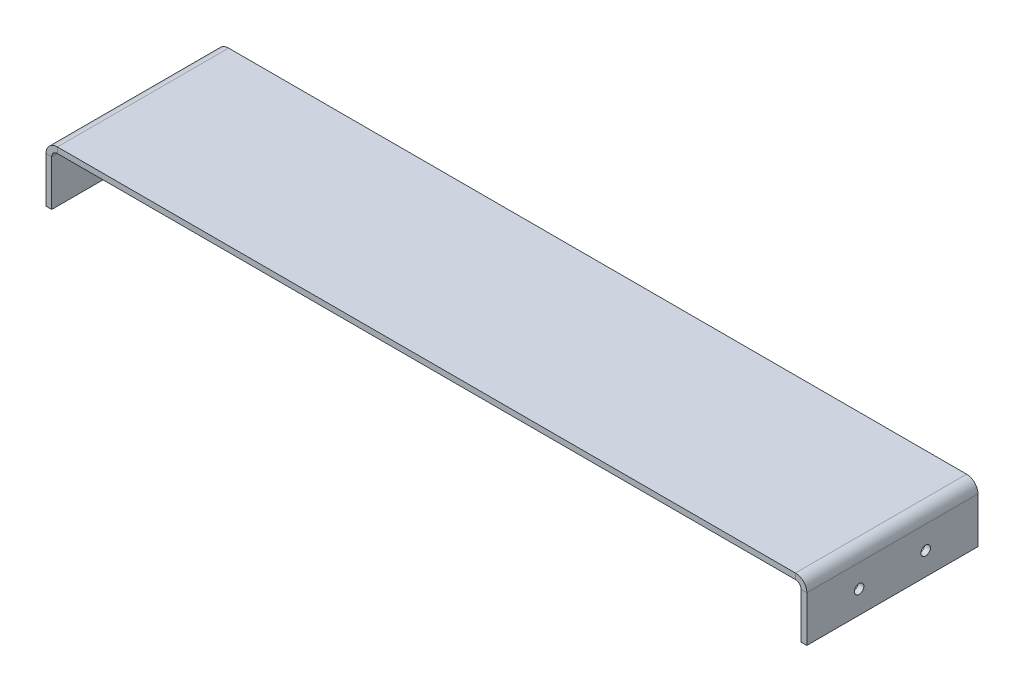
from build123d import *

# Parameters (mm, degrees)
SKETCH1_W                      = 400
SKETCH1_H                      = 90
BASE_FLANGE1_DEPTH             = 3
EDGE_FLANGE1_STRIP_W           = 18
EDGE_FLANGE1_STRIP_H           = 3
EDGE_FLANGE1_STRIP_CUT_DEPTH   = 90
EDGE_FLANGE1_STRIP_2_W         = 18
EDGE_FLANGE1_STRIP_2_H         = 3
EDGE_FLANGE1_STRIP_CUT_2_DEPTH = 90
EDGE_FLANGE1_DEPTH             = 90
EDGE_FLANGE1_BEND_DEPTH        = 90
SKETCH12_R                     = 2.5
CUT_EXTRUDE1_DEPTH             = 412.096095822


# Sheet-metal steps are written as plain solids
with BuildPart() as part:
    # Sketch1 → Base-Flange1 (new body)
    with BuildSketch(Plane(origin=(0, 0, 0), x_dir=(1, 0, 0), z_dir=(0, 1, 0))):
        with Locations((0, 45)):
            Rectangle(SKETCH1_W, SKETCH1_H)
    extrude(amount=-BASE_FLANGE1_DEPTH)

    # Edge-Flange1 strip (across the edge) → Edge-Flange1 strip cut (cut)
    with BuildSketch(Plane(origin=(-200, -3, 0), x_dir=(1, 0, 0), z_dir=(0, 0, -1))):
        with Locations((-3, -1.5)):
            Rectangle(EDGE_FLANGE1_STRIP_W, EDGE_FLANGE1_STRIP_H)
    extrude(amount=EDGE_FLANGE1_STRIP_CUT_DEPTH, mode=Mode.SUBTRACT)

    # Edge-Flange1 strip 2 (across the edge) → Edge-Flange1 strip cut 2 (cut)
    with BuildSketch(Plane(origin=(200, -3, -90), x_dir=(-1, 0, 0), z_dir=(0, 0, 1))):
        with Locations((-3, -1.5)):
            Rectangle(EDGE_FLANGE1_STRIP_2_W, EDGE_FLANGE1_STRIP_2_H)
    extrude(amount=EDGE_FLANGE1_STRIP_CUT_2_DEPTH, mode=Mode.SUBTRACT)

    # Edge-Flange1 section (across the edge) → Edge-Flange1 (add)
    with BuildSketch(Plane(origin=(-200, -3, 0), x_dir=(1, 0, 0), z_dir=(0, 0, -1))):
        with BuildLine():
            Line((0, 3), (0, 27))
            Line((0, 27), (3, 27))
            Line((3, 27), (3, 3))
            ThreePointArc((3, 3), (3.878679656, 0.878679656), (6, 0))
            Line((6, 0), (6, -3))
            ThreePointArc((6, -3), (1.757359313, -1.242640687), (0, 3))
        make_face()
    extrude(amount=EDGE_FLANGE1_DEPTH)

    # Edge-Flange1 section 2 (across the edge) → Edge-Flange1 bend (add)
    with BuildSketch(Plane(origin=(200, -3, -90), x_dir=(-1, 0, 0), z_dir=(0, 0, 1))):
        with BuildLine():
            Line((0, 3), (0, 27))
            Line((0, 27), (3, 27))
            Line((3, 27), (3, 3))
            ThreePointArc((3, 3), (3.878679656, 0.878679656), (6, 0))
            Line((6, 0), (6, -3))
            ThreePointArc((6, -3), (1.757359313, -1.242640687), (0, 3))
        make_face()
    extrude(amount=EDGE_FLANGE1_BEND_DEPTH)

    # Sketch12 → Cut-Extrude1 (cut, through all)
    with BuildSketch(Plane(origin=(200, 0, 0), x_dir=(0, 0, -1), z_dir=(1, 0, 0))):
        with Locations(Location((62.5, -18, 0), (0, 0, 90))):
            Circle(SKETCH12_R)
        with Locations(Location((27.5, -18, 0), (0, 0, 270))):
            Circle(SKETCH12_R)
    extrude(amount=-CUT_EXTRUDE1_DEPTH, mode=Mode.SUBTRACT)


solid = part.part
